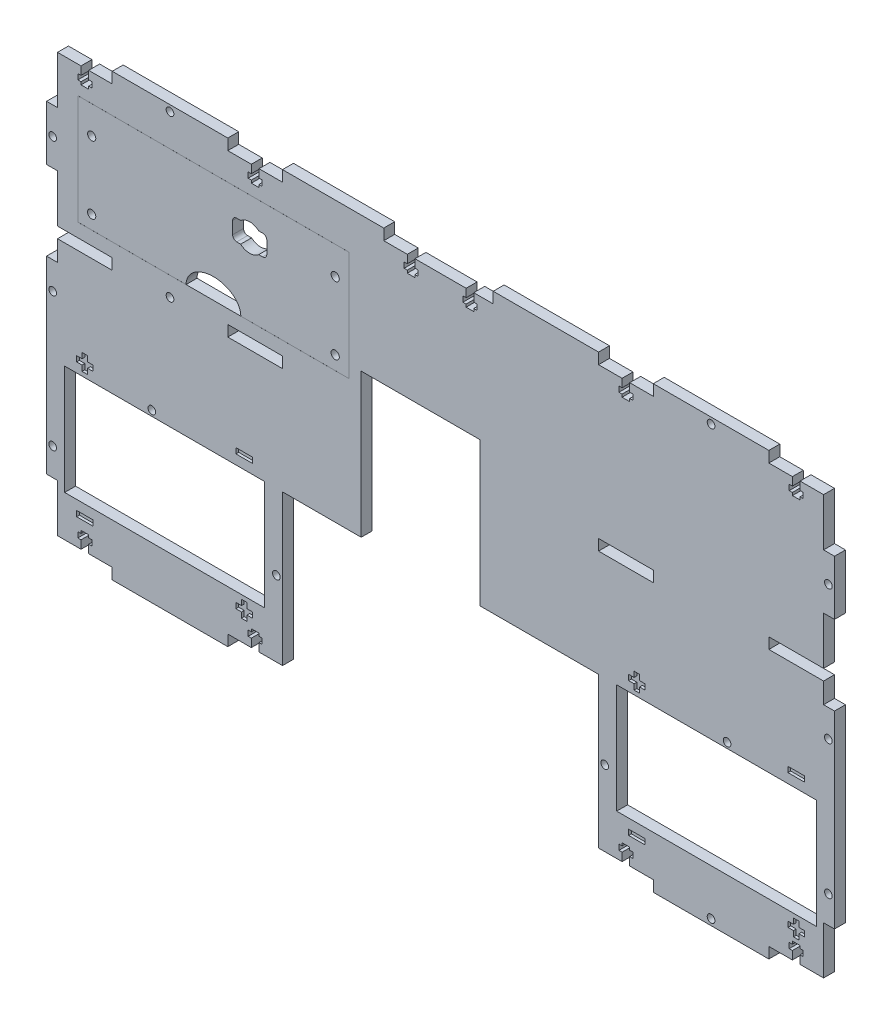
from build123d import *

# Parameters (mm, degrees)
SKETCH_1_R            = 1.4
SKETCH_1_W            = 73
SKETCH_1_H            = 40
SKETCH_1_R_2          = 1.5
SKETCH_1_W_2          = 20
SKETCH_1_H_2          = 4
EXTRUDE_1_DEPTH       = 4
SKETCH_2_W            = 99.02
SKETCH_2_H            = 40.02
SKETCH_2_W_2          = 99
SKETCH_2_H_2          = 40
CUT_EXTRUDE_1_DEPTH   = 166.021968235
SKETCH_3_W            = 6
SKETCH_3_H            = 2
SKETCH_3_W_2          = 2
SKETCH_3_H_2          = 6
CUT_EXTRUDE_1_2_DEPTH = 1
CUT_EXTRUDE_2_DEPTH   = 166.021968235
FILLET_1_R            = 1.5


with BuildPart() as part:
    # Эскиз1 → Бобышка-Вытянуть1 (new body)
    with BuildSketch(Plane.XY):
        Polygon((-144, 10), (-144, -59), (-140, -59), (-140, -76.5), (-131.4, -76.5), (-131.4, -73.5), (-132.55, -73.5), (-132.55, -71.5), (-131.4, -71.5), (-131.4, -70.5), (-128.6, -70.5), (-128.6, -71.5), (-127.45, -71.5), (-127.45, -73.5), (-128.6, -73.5), (-128.6, -76.5), (-120, -76.5), (-120, -80.5), (-77.75, -80.5), (-77.75, -76.5), (-69.15, -76.5), (-69.15, -73.5), (-70.3, -73.5), (-70.3, -71.5), (-69.15, -71.5), (-69.15, -70.5), (-66.35, -70.5), (-66.35, -71.5), (-65.2, -71.5), (-65.2, -73.5), (-66.35, -73.5), (-66.35, -76.5), (-57.75, -76.5), (-57.75, -21.5), (-29, -21.5), (-29, 31.1), (14.5, 31.1), (14.5, -21.5), (57.75, -21.5), (57.75, -76.5), (66.35, -76.5), (66.35, -73.5), (65.2, -73.5), (65.2, -71.5), (66.35, -71.5), (66.35, -70.5), (69.15, -70.5), (69.15, -71.5), (70.3, -71.5), (70.3, -73.5), (69.15, -73.5), (69.15, -76.5), (77.75, -76.5), (77.75, -80.5), (120, -80.5), (120, -76.5), (128.6, -76.5), (128.6, -73.5), (127.45, -73.5), (127.45, -71.5), (128.6, -71.5), (128.6, -70.5), (131.4, -70.5), (131.4, -71.5), (132.55, -71.5), (132.55, -73.5), (131.4, -73.5), (131.4, -76.5), (140, -76.5), (140, -59), (144, -59), (144, 10), (140, 10), (140, 17.5), (120, 17.5), (120, 21.5), (140, 21.5), (140, 39), (144, 39), (144, 59), (140, 59), (140, 76.5), (131.4, 76.5), (131.4, 73.5), (132.55, 73.5), (132.55, 71.5), (131.4, 71.5), (131.4, 70.5), (128.6, 70.5), (128.6, 71.5), (127.45, 71.5), (127.45, 73.5), (128.6, 73.5), (128.6, 76.5), (120, 76.5), (120, 80.5), (77.75, 80.5), (77.75, 76.5), (69.15, 76.5), (69.15, 73.5), (70.3, 73.5), (70.3, 71.5), (69.15, 71.5), (69.15, 70.5), (66.35, 70.5), (66.35, 71.5), (65.2, 71.5), (65.2, 73.5), (66.35, 73.5), (66.35, 76.5), (57.75, 76.5), (57.75, 80.5), (19.25, 80.5), (19.25, 76.5), (12.15, 76.5), (12.15, 73.5), (13.3, 73.5), (13.3, 71.5), (12.15, 71.5), (12.15, 70.5), (9.35, 70.5), (9.35, 71.5), (8.2, 71.5), (8.2, 73.5), (9.35, 73.5), (9.35, 76.5), (-9.35, 76.5), (-9.35, 73.5), (-8.2, 73.5), (-8.2, 71.5), (-9.35, 71.5), (-9.35, 70.5), (-12.15, 70.5), (-12.15, 71.5), (-13.3, 71.5), (-13.3, 73.5), (-12.15, 73.5), (-12.15, 76.5), (-20.75, 76.5), (-20.75, 80.5), (-57.75, 80.5), (-57.75, 76.5), (-66.35, 76.5), (-66.35, 73.5), (-65.2, 73.5), (-65.2, 71.5), (-66.35, 71.5), (-66.35, 70.5), (-69.15, 70.5), (-69.15, 71.5), (-70.3, 71.5), (-70.3, 73.5), (-69.15, 73.5), (-69.15, 76.5), (-77.75, 76.5), (-77.75, 80.5), (-120, 80.5), (-120, 76.5), (-128.6, 76.5), (-128.6, 73.5), (-127.45, 73.5), (-127.45, 71.5), (-128.6, 71.5), (-128.6, 70.5), (-131.4, 70.5), (-131.4, 71.5), (-132.55, 71.5), (-132.55, 73.5), (-131.4, 73.5), (-131.4, 76.5), (-140, 76.5), (-140, 59), (-144, 59), (-144, 39), (-140, 39), (-140, 21.5), (-120, 21.5), (-120, 17.5), (-140, 17.5), (-140, 10), align=None)
        with Locations((-141.75, -49)):
            Circle(SKETCH_1_R, mode=Mode.SUBTRACT)
        with Locations((-100.875, -41.5)):
            Rectangle(SKETCH_1_W, SKETCH_1_H, mode=Mode.SUBTRACT)
        with Locations((-60, -49)):
            Circle(SKETCH_1_R, mode=Mode.SUBTRACT)
        with Locations((-141.75, 0)):
            Circle(SKETCH_1_R, mode=Mode.SUBTRACT)
        with Locations((-105.5, -19.5)):
            Circle(SKETCH_1_R, mode=Mode.SUBTRACT)
        with Locations((60, -49)):
            Circle(SKETCH_1_R, mode=Mode.SUBTRACT)
        with Locations((98.875, -78.25)):
            Circle(SKETCH_1_R, mode=Mode.SUBTRACT)
        with Locations((100.875, -41.5)):
            Rectangle(SKETCH_1_W, SKETCH_1_H, mode=Mode.SUBTRACT)
        with Locations((141.75, -49)):
            Circle(SKETCH_1_R, mode=Mode.SUBTRACT)
        with Locations((104.75, -19.5)):
            Circle(SKETCH_1_R, mode=Mode.SUBTRACT)
        with Locations((141.75, 0)):
            Circle(SKETCH_1_R, mode=Mode.SUBTRACT)
        with Locations((-98.875, 19.5)):
            Circle(SKETCH_1_R, mode=Mode.SUBTRACT)
        with Locations((-127.5, 31.5)):
            Circle(SKETCH_1_R_2, mode=Mode.SUBTRACT)
        with Locations((-67.75, 19.5)):
            Rectangle(SKETCH_1_W_2, SKETCH_1_H_2, mode=Mode.SUBTRACT)
        with Locations((-38.5, 31.5)):
            Circle(SKETCH_1_R_2, mode=Mode.SUBTRACT)
        with Locations((-141.75, 49)):
            Circle(SKETCH_1_R, mode=Mode.SUBTRACT)
        with Locations((-127.5, 56.25)):
            Circle(SKETCH_1_R_2, mode=Mode.SUBTRACT)
        with Locations((-98.875, 78.25)):
            Circle(SKETCH_1_R, mode=Mode.SUBTRACT)
        with Locations((-38.5, 56.25)):
            Circle(SKETCH_1_R_2, mode=Mode.SUBTRACT)
        with Locations((67.75, 19.5)):
            Rectangle(SKETCH_1_W_2, SKETCH_1_H_2, mode=Mode.SUBTRACT)
        with Locations((141.75, 49)):
            Circle(SKETCH_1_R, mode=Mode.SUBTRACT)
        with Locations((98.875, 78.25)):
            Circle(SKETCH_1_R, mode=Mode.SUBTRACT)
    extrude(amount=EXTRUDE_1_DEPTH)

    # Эскиз2 → Cut-Extrude 1 (cut, through all)
    with BuildSketch(Plane.XY.offset(4)):
        with Locations((-83, 46.5)):
            Rectangle(SKETCH_2_W, SKETCH_2_H)
        with Locations((-83, 46.5)):
            Rectangle(SKETCH_2_W_2, SKETCH_2_H_2, mode=Mode.SUBTRACT)
    extrude(amount=-CUT_EXTRUDE_1_DEPTH, mode=Mode.SUBTRACT)


with BuildPart() as cut_extrude_1_piece_1:
    # of the separate pieces the step leaves, piece 1, a body of its own (cut_extrude_1_pieces)
    add(part.part.solids().sort_by_distance((-144, 59, 0))[0])

    # Эскиз3 → Cut-Extrude 1 2 (cut)
    with BuildSketch(Plane.XY.offset(4)):
        with Locations((130, -66)):
            Rectangle(SKETCH_3_W, SKETCH_3_H)
        with Locations((130, -66)):
            Rectangle(SKETCH_3_W_2, SKETCH_3_H_2)
        with Locations((71.75, -66)):
            Rectangle(SKETCH_3_W, SKETCH_3_H)
        with Locations((71.75, -17)):
            Rectangle(SKETCH_3_W, SKETCH_3_H)
        with Locations((71.75, -17)):
            Rectangle(SKETCH_3_W_2, SKETCH_3_H_2)
        with Locations((130, -17)):
            Rectangle(SKETCH_3_W, SKETCH_3_H)
        with Locations((-130, -17)):
            Rectangle(SKETCH_3_W, SKETCH_3_H)
        with Locations((-130, -17)):
            Rectangle(SKETCH_3_W_2, SKETCH_3_H_2)
        with Locations((-71.75, -17)):
            Rectangle(SKETCH_3_W, SKETCH_3_H)
        with Locations((-71.75, -66)):
            Rectangle(SKETCH_3_W, SKETCH_3_H)
        with Locations((-71.75, -66)):
            Rectangle(SKETCH_3_W_2, SKETCH_3_H_2)
        with Locations((-130, -66)):
            Rectangle(SKETCH_3_W, SKETCH_3_H)
    extrude(amount=-CUT_EXTRUDE_1_2_DEPTH, mode=Mode.SUBTRACT)


with BuildPart() as cut_extrude_1_piece_2:
    # of the separate pieces the step leaves, piece 2, a body of its own (cut_extrude_1_pieces)
    add(part.part.solids().sort_by_distance((-33.5, 66.5, 0))[0])

    # Эскиз4 → Вырез-Вытянуть2 (cut, through all)
    with BuildSketch(Plane.XY.offset(4)):
        with BuildLine():
            add(Edge.make_bspline(
                [(-73, 26.5), (-73, 34), (-83, 34), (-93, 34), (-93, 26.5)],
                knots=[3.141592654, 3.141592654, 3.141592654, 4.71238898, 4.71238898, 6.283185307, 6.283185307, 6.283185307], degree=2, weights=[1, 0.707106781, 1, 0.707106781, 1]))
            Line((-93, 26.5), (-73, 26.5))
        make_face()
        with BuildLine():
            Line((-76, 56.75), (-76, 49.25))
            Line((-76, 49.25), (-73.057189139, 49.25))
            ThreePointArc((-73.057189139, 49.25), (-69.75, 48), (-66.442810861, 49.25))
            Line((-66.442810861, 49.25), (-63.5, 49.25))
            Line((-63.5, 49.25), (-63.5, 56.75))
            Line((-63.5, 56.75), (-66.442810861, 56.75))
            ThreePointArc((-66.442810861, 56.75), (-69.75, 58), (-73.057189139, 56.75))
            Line((-73.057189139, 56.75), (-76, 56.75))
        make_face()
    extrude(amount=-CUT_EXTRUDE_2_DEPTH, mode=Mode.SUBTRACT)

    # Скругление1
    fillet_1_edges = [cut_extrude_1_piece_2.edges().sort_by_distance(p)[0] for p in [
        (-76, 56.75, 2),
        (-76, 49.25, 2),
        (-63.5, 49.25, 2),
        (-63.5, 56.75, 2),
    ]]
    fillet(fillet_1_edges, radius=FILLET_1_R)


solid = Compound([cut_extrude_1_piece_1.part, cut_extrude_1_piece_2.part])
